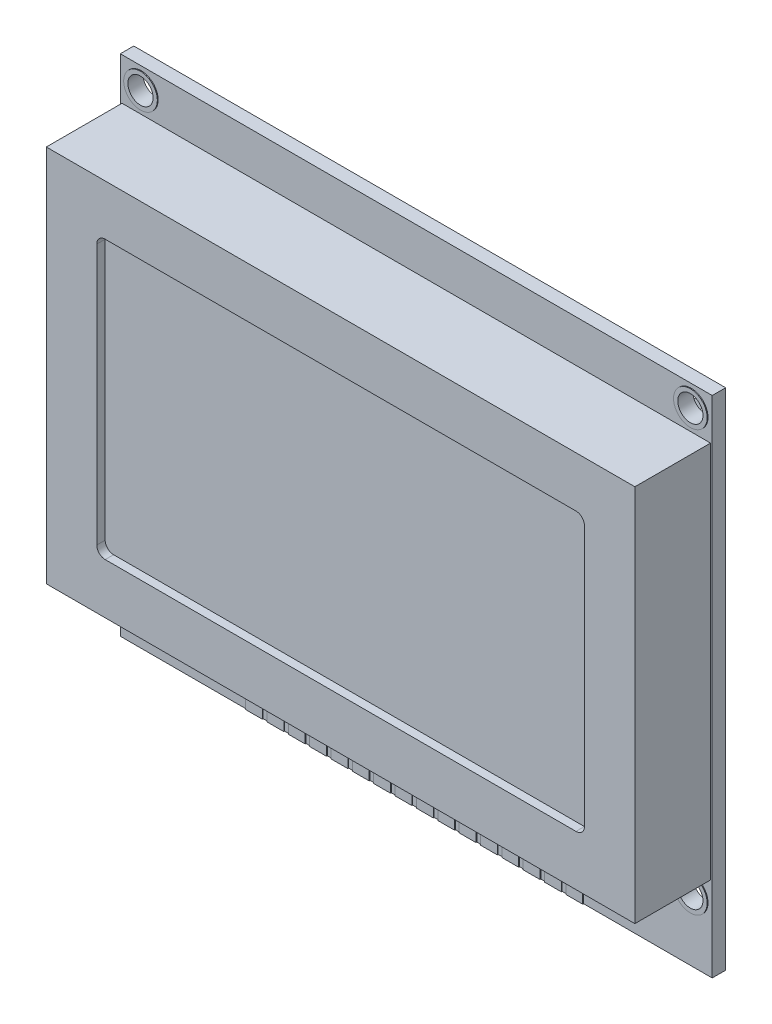
from build123d import *

# Parameters (mm, degrees)
SKETCH1_W            = 70.4
SKETCH1_H            = 60
BASE_PCB_DEPTH       = 1.6
SKETCH5_W            = 70
SKETCH5_H            = 45
METAL_SHIELD_DEPTH   = 9
SOLDER_DEPTH         = 0.1
SOLDER_DEPTH_BACK    = 1.7
SKETCH_1_R           = 2
SKETCH_2_R           = 1.5
SKETCH_2_R_2         = 0.5
DRIL_DEPTH           = 48.098301456
GLASS_DEPTH          = 1
SHIELD_CLIP_DEPTH    = 2.6
LPATTERN1_COUNT      = 3
LPATTERN1_PITCH      = 28
LPATTERN1_COUNT_DIR2 = 2
LPATTERN1_PITCH_DIR2 = 40
SKETCH8_R            = 7
SKETCH8_R_2          = 7.366245051
SKETCH8_R_3          = 7.745103812
IC_DEPTH             = 2
IC_FILLET_R          = 10.5


with BuildPart() as part:
    # Sketch1 → base pcb (new body)
    with BuildSketch(Plane.XY):
        Rectangle(SKETCH1_W, SKETCH1_H)
    extrude(amount=BASE_PCB_DEPTH)

    # Sketch5 → metal shield (add)
    with BuildSketch(Plane.XY.offset(1.6)):
        with Locations((0, 2.5)):
            Rectangle(SKETCH5_W, SKETCH5_H)
    extrude(amount=METAL_SHIELD_DEPTH)

    # Эскиз1 → Solder (add, two sides: drawn at the far end of the back side and taken through both)
    with BuildSketch(Plane.XY.offset(1.6).offset(-SOLDER_DEPTH_BACK)):
        with Locations((-32.7, 27.5)):
            Circle(SKETCH_1_R)
        with Locations((32.7, 27.5)):
            Circle(SKETCH_1_R)
        with Locations((32.7, -22.5)):
            Circle(SKETCH_1_R)
        with Locations((-32.7, -22.5)):
            Circle(SKETCH_1_R)
        with BuildLine():
            Line((-20.2, -27.5), (-20.2, -30))
            Line((-20.2, -30), (-18.2, -30))
            Line((-18.2, -30), (-18.2, -27.5))
            ThreePointArc((-18.2, -27.5), (-19.2, -26.5), (-20.2, -27.5))
        make_face()
        with BuildLine():
            Line((-17.66, -27.5), (-17.66, -30))
            Line((-17.66, -30), (-15.66, -30))
            Line((-15.66, -30), (-15.66, -27.5))
            ThreePointArc((-15.66, -27.5), (-16.66, -26.5), (-17.66, -27.5))
        make_face()
        with BuildLine():
            Line((-15.12, -27.5), (-15.12, -30))
            Line((-15.12, -30), (-13.12, -30))
            Line((-13.12, -30), (-13.12, -27.5))
            ThreePointArc((-13.12, -27.5), (-14.12, -26.5), (-15.12, -27.5))
        make_face()
        with BuildLine():
            Line((-12.58, -27.5), (-12.58, -30))
            Line((-12.58, -30), (-10.58, -30))
            Line((-10.58, -30), (-10.58, -27.5))
            ThreePointArc((-10.58, -27.5), (-11.58, -26.5), (-12.58, -27.5))
        make_face()
        with BuildLine():
            Line((-10.04, -27.5), (-10.04, -30))
            Line((-10.04, -30), (-8.04, -30))
            Line((-8.04, -30), (-8.04, -27.5))
            ThreePointArc((-8.04, -27.5), (-9.04, -26.5), (-10.04, -27.5))
        make_face()
        with BuildLine():
            Line((-7.5, -27.5), (-7.5, -30))
            Line((-7.5, -30), (-5.5, -30))
            Line((-5.5, -30), (-5.5, -27.5))
            ThreePointArc((-5.5, -27.5), (-6.5, -26.5), (-7.5, -27.5))
        make_face()
        with BuildLine():
            Line((-4.96, -27.5), (-4.96, -30))
            Line((-4.96, -30), (-2.96, -30))
            Line((-2.96, -30), (-2.96, -27.5))
            ThreePointArc((-2.96, -27.5), (-3.96, -26.5), (-4.96, -27.5))
        make_face()
        with BuildLine():
            Line((-2.42, -27.5), (-2.42, -30))
            Line((-2.42, -30), (-0.42, -30))
            Line((-0.42, -30), (-0.42, -27.5))
            ThreePointArc((-0.42, -27.5), (-1.42, -26.5), (-2.42, -27.5))
        make_face()
        with BuildLine():
            Line((0.12, -27.5), (0.12, -30))
            Line((0.12, -30), (2.12, -30))
            Line((2.12, -30), (2.12, -27.5))
            ThreePointArc((2.12, -27.5), (1.12, -26.5), (0.12, -27.5))
        make_face()
        with BuildLine():
            Line((2.66, -27.5), (2.66, -30))
            Line((2.66, -30), (4.66, -30))
            Line((4.66, -30), (4.66, -27.5))
            ThreePointArc((4.66, -27.5), (3.66, -26.5), (2.66, -27.5))
        make_face()
        with BuildLine():
            Line((5.2, -27.5), (5.2, -30))
            Line((5.2, -30), (7.2, -30))
            Line((7.2, -30), (7.2, -27.5))
            ThreePointArc((7.2, -27.5), (6.2, -26.5), (5.2, -27.5))
        make_face()
        with BuildLine():
            Line((7.74, -27.5), (7.74, -30))
            Line((7.74, -30), (9.74, -30))
            Line((9.74, -30), (9.74, -27.5))
            ThreePointArc((9.74, -27.5), (8.74, -26.5), (7.74, -27.5))
        make_face()
        with BuildLine():
            Line((10.28, -27.5), (10.28, -30))
            Line((10.28, -30), (12.28, -30))
            Line((12.28, -30), (12.28, -27.5))
            ThreePointArc((12.28, -27.5), (11.28, -26.5), (10.28, -27.5))
        make_face()
        with BuildLine():
            Line((12.82, -27.5), (12.82, -30))
            Line((12.82, -30), (14.82, -30))
            Line((14.82, -30), (14.82, -27.5))
            ThreePointArc((14.82, -27.5), (13.82, -26.5), (12.82, -27.5))
        make_face()
        with BuildLine():
            Line((15.36, -27.5), (15.36, -30))
            Line((15.36, -30), (17.36, -30))
            Line((17.36, -30), (17.36, -27.5))
            ThreePointArc((17.36, -27.5), (16.36, -26.5), (15.36, -27.5))
        make_face()
        with BuildLine():
            Line((17.9, -27.5), (17.9, -30))
            Line((17.9, -30), (19.9, -30))
            Line((19.9, -30), (19.9, -27.5))
            ThreePointArc((19.9, -27.5), (18.9, -26.5), (17.9, -27.5))
        make_face()
    extrude(amount=SOLDER_DEPTH + SOLDER_DEPTH_BACK)

    # Эскиз2 → Dril (cut, through all)
    with BuildSketch(Plane.XY.offset(1.7)):
        with Locations((-32.7, 27.5)):
            Circle(SKETCH_2_R)
        with Locations((32.7, 27.5)):
            Circle(SKETCH_2_R)
        with Locations((32.7, -22.5)):
            Circle(SKETCH_2_R)
        with Locations((-32.7, -22.5)):
            Circle(SKETCH_2_R)
        with Locations((-19.2, -27.5)):
            Circle(SKETCH_2_R_2)
        with Locations((-16.66, -27.5)):
            Circle(SKETCH_2_R_2)
        with Locations((-14.12, -27.5)):
            Circle(SKETCH_2_R_2)
        with Locations((-11.58, -27.5)):
            Circle(SKETCH_2_R_2)
        with Locations((-9.04, -27.5)):
            Circle(SKETCH_2_R_2)
        with Locations((-6.5, -27.5)):
            Circle(SKETCH_2_R_2)
        with Locations((-3.96, -27.5)):
            Circle(SKETCH_2_R_2)
        with Locations((-1.42, -27.5)):
            Circle(SKETCH_2_R_2)
        with Locations((1.12, -27.5)):
            Circle(SKETCH_2_R_2)
        with Locations((3.66, -27.5)):
            Circle(SKETCH_2_R_2)
        with Locations((6.2, -27.5)):
            Circle(SKETCH_2_R_2)
        with Locations((8.74, -27.5)):
            Circle(SKETCH_2_R_2)
        with Locations((11.28, -27.5)):
            Circle(SKETCH_2_R_2)
        with Locations((13.82, -27.5)):
            Circle(SKETCH_2_R_2)
        with Locations((16.36, -27.5)):
            Circle(SKETCH_2_R_2)
        with Locations((18.9, -27.5)):
            Circle(SKETCH_2_R_2)
    extrude(amount=-DRIL_DEPTH, mode=Mode.SUBTRACT)

    # Sketch6 → glass (cut)
    with BuildSketch(Plane.XY.offset(10.6)):
        with BuildLine():
            Line((-28, 19), (28, 19))
            ThreePointArc((28, 19), (28.707106781, 18.707106781), (29, 18))
            Line((29, 18), (29, -13))
            ThreePointArc((29, -13), (28.707106781, -13.707106781), (28, -14))
            Line((28, -14), (-28, -14))
            ThreePointArc((-28, -14), (-28.707106781, -13.707106781), (-29, -13))
            Line((-29, -13), (-29, 18))
            ThreePointArc((-29, 18), (-28.707106781, 18.707106781), (-28, 19))
        make_face()
    extrude(amount=-GLASS_DEPTH, mode=Mode.SUBTRACT)

    # Sketch7 → shield_clip (add)
    with BuildSketch(Plane(origin=(0, 0, 0), x_dir=(-1, 0, 0), z_dir=(0, 0, -1))):
        Polygon((-30.7, 24.792893219), (-27.164466094, 21.257359313), (-26.457359313, 21.964466094), (-29.992893219, 25.5), align=None)
    shield_clip = extrude(amount=SHIELD_CLIP_DEPTH)

    # LPattern1: shield_clip 3 × 2
    with Locations(*[(-i * LPATTERN1_PITCH, -j * LPATTERN1_PITCH_DIR2, 0) for i in range(LPATTERN1_COUNT) for j in range(LPATTERN1_COUNT_DIR2) if (i, j) != (0, 0)]):
        add(shield_clip)

    # Sketch8 → IC (add)
    with BuildSketch(Plane(origin=(0, 0, 0), x_dir=(-1, 0, 0), z_dir=(0, 0, -1))):
        with Locations(Location((-16.516806041, 2.638980249, 0), (0, 0, 180))):
            Circle(SKETCH8_R)
        with Locations(Location((5.261461487, 4.245604471, 0), (0, 0, 180))):
            Circle(SKETCH8_R_2)
        with Locations(Location((26.00679982, 1.064566419, 0), (0, 0, 180))):
            Circle(SKETCH8_R_3)
    extrude(amount=IC_DEPTH)

    # IC fillet
    # the kernel refuses this fillet: 10.5 mm, written as the material it takes off along each edge
    with BuildSketch(Plane(origin=(16.516806041, 2.638980249, -2), x_dir=(1, 0, 0), z_dir=(0, 1, 0))) as ic_fillet_piece_1:
        with BuildLine():
            CenterArc((0.835585997, -10.5), IC_FILLET_R, 54.04943238, 35.95056762)
            Line((0.835585997, 0), (0.835585997, 0.21))
            Line((0.835585997, 0.21), (7, 0.21))
            Line((7, 0.21), (7.21, 0))
            ThreePointArc((7.21, 0), (7.21, -1), (7.12328828, -1.83))
            Line((7.12328828, -1.83), (7, -2))
        make_face()
    revolve(axis=Axis((16.516806041, 2.638980249, -2), (0, 0, -1)), mode=Mode.SUBTRACT)
    with BuildSketch(Plane(origin=(-5.261461487, 4.245604471, -2), x_dir=(1, 0, 0), z_dir=(0, 1, 0))) as ic_fillet_piece_2:
        with BuildLine():
            CenterArc((1.201831048, -10.5), IC_FILLET_R, 54.04943238, 35.95056762)
            Line((1.201831048, 0), (1.201831048, 0.21))
            Line((1.201831048, 0.21), (7.366245051, 0.21))
            Line((7.366245051, 0.21), (7.576245051, 0))
            ThreePointArc((7.576245051, 0), (7.576245051, -1), (7.489533331, -1.83))
            Line((7.489533331, -1.83), (7.366245051, -2))
        make_face()
    revolve(axis=Axis((-5.261461487, 4.245604471, -2), (0, 0, -1)), mode=Mode.SUBTRACT)
    with BuildSketch(Plane(origin=(-26.00679982, 1.064566419, -2), x_dir=(1, 0, 0), z_dir=(0, 1, 0))) as ic_fillet_piece_3:
        with BuildLine():
            CenterArc((1.580689809, -10.5), IC_FILLET_R, 54.04943238, 35.95056762)
            Line((1.580689809, 0), (1.580689809, 0.21))
            Line((1.580689809, 0.21), (7.745103812, 0.21))
            Line((7.745103812, 0.21), (7.955103812, 0))
            ThreePointArc((7.955103812, 0), (7.955103812, -1), (7.868392092, -1.83))
            Line((7.868392092, -1.83), (7.745103812, -2))
        make_face()
    revolve(axis=Axis((-26.00679982, 1.064566419, -2), (0, 0, -1)), mode=Mode.SUBTRACT)


solid = part.part
